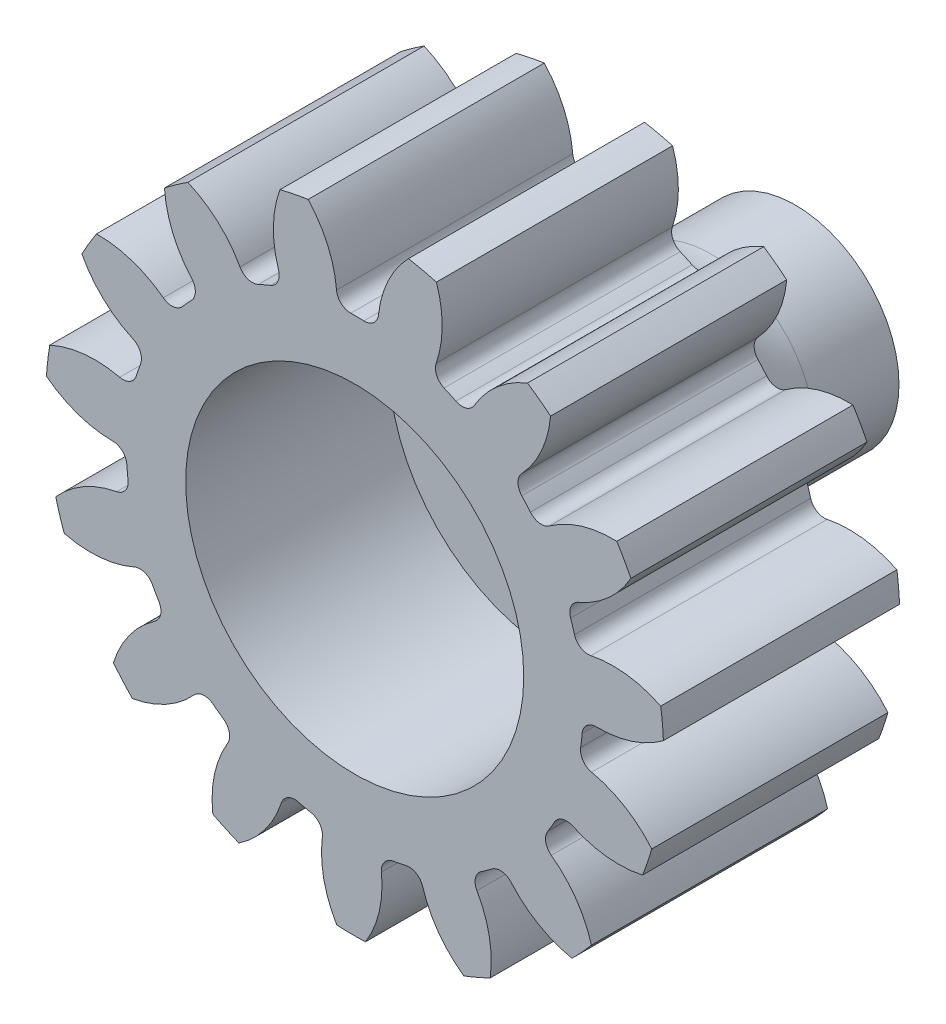
from build123d import *

# Parameters (mm, degrees)
SKETCH3_R         = 21.59
GEARBODY_DEPTH    = 11
TOOTHCUT_DEPTH    = 33.453908855
CIRPATTERN1_COUNT = 15
SCALE1_SCALE_X    = 0.666666667
SCALE1_SCALE_Y    = 0.666666667
SCALE1_SCALE_Z    = 1
BOREDIA_R         = 7.874
BORE_DEPTH        = 12700


with BuildPart() as part:
    # Sketch3 → gearBody (new body)
    with BuildSketch(Plane.XY):
        Circle(SKETCH3_R)
    extrude(amount=GEARBODY_DEPTH)

    # Sketch2 → toothCut (cut, through all)
    with BuildSketch(Plane.XY):
        with BuildLine():
            ThreePointArc((15.783846764, -2.304552616), (15.843293638, -1.852249483), (15.889781974, -1.39843136))
            ThreePointArc((15.889781974, -1.39843136), (16.213055843, -0.751556907), (16.890861518, -0.499501321))
            ThreePointArc((16.890861518, -0.499501321), (20.504912911, 0.340315353), (23.283949955, 2.798691365))
            ThreePointArc((23.283949955, 2.798691365), (23.292901215, -2.723187818), (22.010467945, -8.09409042))
            ThreePointArc((22.010467945, -8.09409042), (19.873444675, -5.060974685), (16.550574786, -3.410158156))
            ThreePointArc((16.550574786, -3.410158156), (15.949189176, -3.008551507), (15.783846764, -2.304552616))
        make_face()
    toothcut = extrude(amount=TOOTHCUT_DEPTH, mode=Mode.SUBTRACT)

    # CirPattern1: toothCut ×15 about axis
    cirpattern1_axis = Axis((0, 0, 11), (0, 0, -1))
    for i in range(1, CIRPATTERN1_COUNT):
        add(toothcut.rotate(cirpattern1_axis, i * 360 / CIRPATTERN1_COUNT), mode=Mode.SUBTRACT)


with BuildPart() as part_1:
    # Scale1: scaled about (0, 0, 5.5)
    add(part.part.scale((SCALE1_SCALE_X, SCALE1_SCALE_Y, SCALE1_SCALE_Z), about=(0, 0, 5.5)))

    # boreDia → bore (cut, symmetric)
    with BuildSketch(Plane.XY):
        Circle(BOREDIA_R)
    extrude(amount=BORE_DEPTH, both=True, mode=Mode.SUBTRACT)

    # Sketch4 → Revolve1 (revolve)
    with BuildSketch(Plane(origin=(0, 0, 0), x_dir=(0, 0, -1), z_dir=(1, 0, 0))):
        with BuildLine():
            Line((9.525, 0), (-1.524, 0))
            Line((-1.524, 0), (-1.524, 7.874))
            Line((-1.524, 7.874), (0, 7.874))
            Line((0, 7.874), (0, 10.414))
            ThreePointArc((0, 10.414), (1.636687307, 6.462687307), (5.588, 4.826))
            Line((5.588, 4.826), (9.525, 4.826))
            Line((9.525, 4.826), (9.525, 0))
        make_face()
    revolve(axis=Axis((0, 0, 0), (0, 0, -1)))


solid = part_1.part
